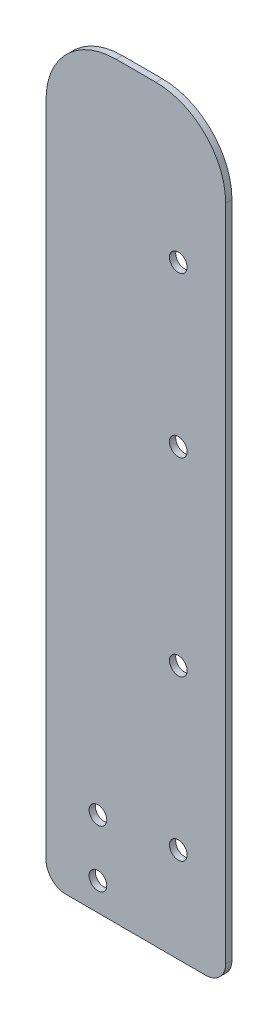
from build123d import *

# Parameters (mm, degrees)
SKETCH1_R           = 2.2479
BOSS_EXTRUDE2_DEPTH = 1.6002


with BuildPart() as part:
    # Sketch1 → Boss-Extrude2 (new body)
    with BuildSketch(Plane.XY):
        with BuildLine():
            Line((45.72, 5.08), (45.72, 172.72))
            ThreePointArc((45.72, 172.72), (40.512358569, 185.292358569), (27.94, 190.5))
            Line((27.94, 190.5), (17.78, 190.5))
            ThreePointArc((17.78, 190.5), (5.207641431, 185.292358569), (0, 172.72))
            Line((0, 172.72), (0, 5.08))
            ThreePointArc((0, 5.08), (1.503493452, 1.526611814), (5.070014314, 0.054542149))
            Line((5.070014314, 0.054542149), (33.655, 0))
            Line((33.655, 0), (40.64, 0))
            ThreePointArc((40.64, 0), (44.232102448, 1.487897552), (45.72, 5.08))
        make_face()
        with Locations((33.655, 24.13)):
            Circle(SKETCH1_R, mode=Mode.SUBTRACT)
        with Locations((33.655, 64.77)):
            Circle(SKETCH1_R, mode=Mode.SUBTRACT)
        with Locations((33.655, 113.03)):
            Circle(SKETCH1_R, mode=Mode.SUBTRACT)
        with Locations((33.655, 153.67)):
            Circle(SKETCH1_R, mode=Mode.SUBTRACT)
        with Locations((13.208, 7.15102725)):
            Circle(SKETCH1_R, mode=Mode.SUBTRACT)
        with Locations((13.208, 21.629053606)):
            Circle(SKETCH1_R, mode=Mode.SUBTRACT)
    extrude(amount=BOSS_EXTRUDE2_DEPTH)


solid = part.part
